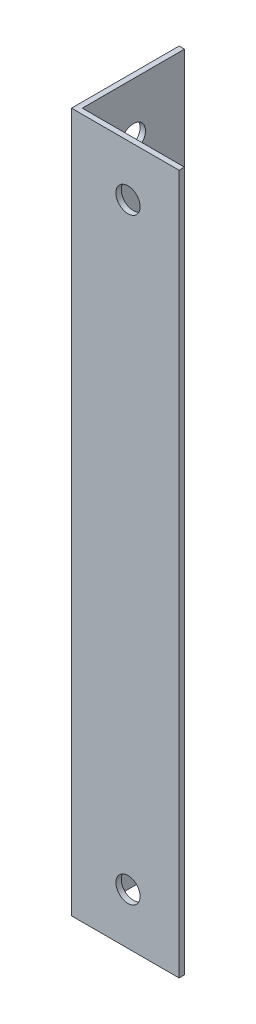
from build123d import *

# Parameters (mm, degrees)
EXTRUDE_1_DEPTH     = 130
SKETCH_2_R          = 2.25
CUT_EXTRUDE_1_DEPTH = 133.894695154
SKETCH_3_R          = 2.25
CUT_EXTRUDE_2_DEPTH = 134.041346957
SKETCH_4_R          = 2.25
CUT_EXTRUDE_3_DEPTH = 133.894695154


with BuildPart() as part:
    # Эскиз1 → Бобышка-Вытянуть1 (new body)
    with BuildSketch(Plane(origin=(0, 0, 0), x_dir=(1, 0, 0), z_dir=(0, 1, 0))):
        Polygon((0, 0), (0, 20), (1, 20), (1, 1), (20, 1), (20, 0), align=None)
    extrude(amount=EXTRUDE_1_DEPTH)

    # Эскиз2 → Вырез-Вытянуть1 (cut, through all)
    with BuildSketch(Plane(origin=(0, 0, -1), x_dir=(-1, 0, 0), z_dir=(0, 0, -1))):
        with Locations((-10.5, 9.5)):
            Circle(SKETCH_2_R)
    extrude(amount=-CUT_EXTRUDE_1_DEPTH, mode=Mode.SUBTRACT)

    # Эскиз3 → Вырез-Вытянуть2 (cut, through all)
    with BuildSketch(Plane.ZY):
        with Locations((-10.5, 13.5)):
            Circle(SKETCH_3_R)
        with Locations((-10.5, 120.5)):
            Circle(SKETCH_3_R)
    extrude(amount=-CUT_EXTRUDE_2_DEPTH, mode=Mode.SUBTRACT)

    # Эскиз4 → Вырез-Вытянуть3 (cut, through all)
    with BuildSketch(Plane(origin=(0, 0, -1), x_dir=(-1, 0, 0), z_dir=(0, 0, -1))):
        with Locations((-10.5, 120.5)):
            Circle(SKETCH_4_R)
    extrude(amount=-CUT_EXTRUDE_3_DEPTH, mode=Mode.SUBTRACT)


solid = part.part
